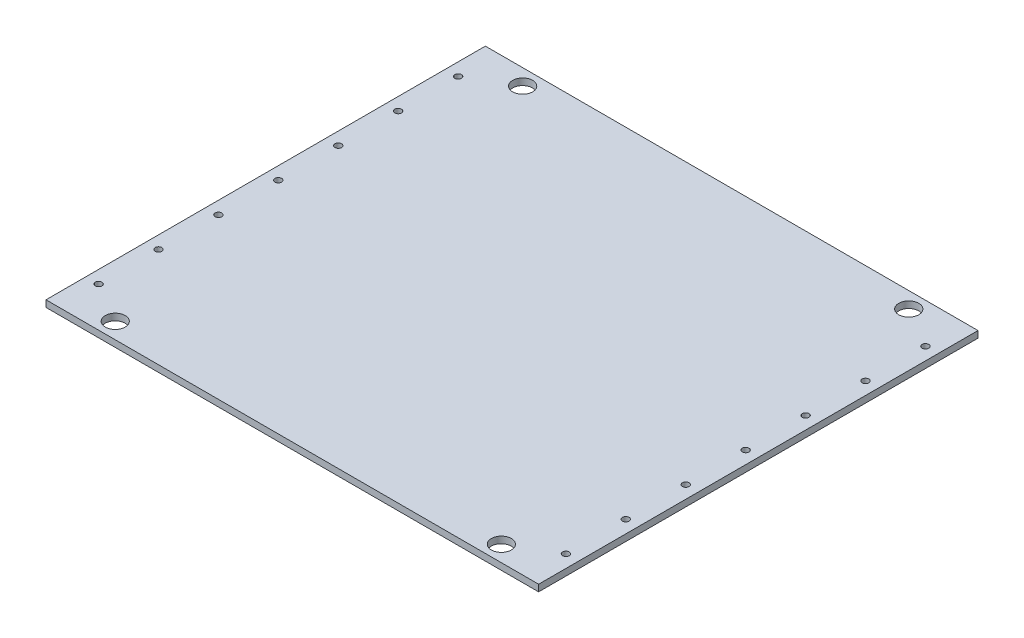
from build123d import *

# Parameters (mm, degrees)
SKETCH_1_W          = 370
SKETCH_1_H          = 330
EXTRUDE_1_DEPTH     = 5
SKETCH_3_W          = 220
SKETCH_3_H          = 20
CUT_EXTRUDE_2_DEPTH = 248.941525364
SKETCH_9_W          = 239.54111937
SKETCH_9_H          = 233.56752537
EXTRUDE_2_DEPTH     = 5
SKETCH_12_R         = 2.5
CUT_EXTRUDE_6_DEPTH = 10
SKETCH_13_R         = 7.5
CUT_EXTRUDE_7_DEPTH = 10


with BuildPart() as part:
    # 草图1 → 凸台-拉伸1 (new body)
    with BuildSketch(Plane(origin=(0, 0, 0), x_dir=(1, 0, 0), z_dir=(0, 1, 0))):
        Rectangle(SKETCH_1_W, SKETCH_1_H)
    extrude(amount=EXTRUDE_1_DEPTH)

    # 草图3 → 切除-拉伸2 (cut, through all)
    with BuildSketch(Plane(origin=(0, 5, 0), x_dir=(1, 0, 0), z_dir=(0, 1, 0))):
        with Locations((0, 50)):
            Rectangle(SKETCH_3_W, SKETCH_3_H)
        with Locations((0, 100)):
            Rectangle(SKETCH_3_W, SKETCH_3_H)
        Rectangle(SKETCH_3_W, SKETCH_3_H)
        with Locations((0, -50)):
            Rectangle(SKETCH_3_W, SKETCH_3_H)
        with Locations((0, -100)):
            Rectangle(SKETCH_3_W, SKETCH_3_H)
    extrude(amount=-CUT_EXTRUDE_2_DEPTH, mode=Mode.SUBTRACT)

    # 草图9 → 凸台-拉伸2 (add)
    with BuildSketch(Plane(origin=(0, 5, 0), x_dir=(1, 0, 0), z_dir=(0, 1, 0))):
        with Locations((2.0907579, 0.2986797)):
            Rectangle(SKETCH_9_W, SKETCH_9_H)
    extrude(amount=-EXTRUDE_2_DEPTH)

    # 草图12 → 切除-拉伸6 (cut)
    with BuildSketch(Plane(origin=(0, 5, 0), x_dir=(1, 0, 0), z_dir=(0, 1, 0))):
        with Locations((175.5, 0)):
            Circle(SKETCH_12_R)
        with Locations((175.5, 45)):
            Circle(SKETCH_12_R)
        with Locations((175.5, 90)):
            Circle(SKETCH_12_R)
        with Locations((175.5, 135)):
            Circle(SKETCH_12_R)
        with Locations((175.5, -135)):
            Circle(SKETCH_12_R)
        with Locations((175.5, -90)):
            Circle(SKETCH_12_R)
        with Locations((175.5, -45)):
            Circle(SKETCH_12_R)
        with Locations((-175.5, -45)):
            Circle(SKETCH_12_R)
        with Locations((-175.5, -90)):
            Circle(SKETCH_12_R)
        with Locations((-175.5, -135)):
            Circle(SKETCH_12_R)
        with Locations((-175.5, 135)):
            Circle(SKETCH_12_R)
        with Locations((-175.5, 90)):
            Circle(SKETCH_12_R)
        with Locations((-175.5, 45)):
            Circle(SKETCH_12_R)
        with Locations((-175.5, 0)):
            Circle(SKETCH_12_R)
    extrude(amount=-CUT_EXTRUDE_6_DEPTH, mode=Mode.SUBTRACT)

    # 草图13 → 切除-拉伸7 (cut)
    with BuildSketch(Plane(origin=(0, 5, 0), x_dir=(1, 0, 0), z_dir=(0, 1, 0))):
        with Locations((-145, -153)):
            Circle(SKETCH_13_R)
        with Locations((145, -153)):
            Circle(SKETCH_13_R)
        with Locations((145, 153)):
            Circle(SKETCH_13_R)
        with Locations((-145, 153)):
            Circle(SKETCH_13_R)
    extrude(amount=-CUT_EXTRUDE_7_DEPTH, mode=Mode.SUBTRACT)


solid = part.part
